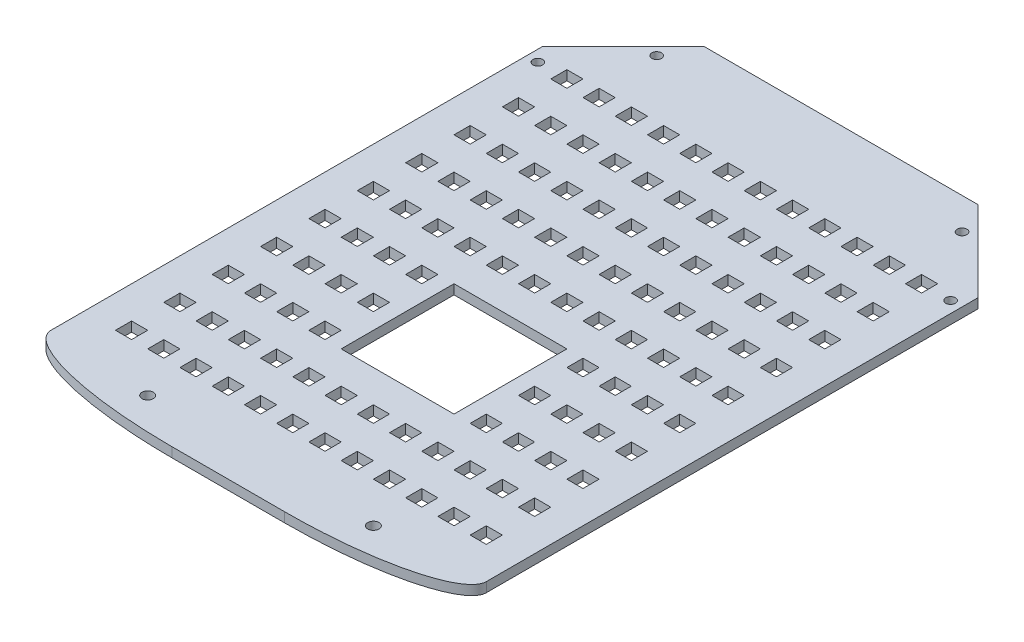
from build123d import *

# Parameters (mm, degrees)
SKETCH2_W           = 135
SKETCH2_H           = 190
BOSS_EXTRUDE2_DEPTH = 3
FILLET1_SIZE        = 50
FILLET1_SIZE_2      = 12.5
FILLET2_SIZE        = 12.5
FILLET2_SIZE_2      = 50
SKETCH6_R           = 1.75
CUT_EXTRUDE4_DEPTH  = 10
CHAMFER4_SIZE       = 25
SKETCH12_R          = 1.5
CUT_EXTRUDE10_DEPTH = 10
SKETCH13_W          = 5
SKETCH13_H          = 5
CUT_EXTRUDE11_DEPTH = 117.577227764
SKETCH14_W          = 35
SKETCH14_H          = 35
CUT_EXTRUDE13_DEPTH = 117.577227764


with BuildPart() as part:
    # Sketch2 → Boss-Extrude2 (new body)
    with BuildSketch(Plane(origin=(0, 0, 0), x_dir=(1, 0, 0), z_dir=(0, 1, 0))):
        Rectangle(SKETCH2_W, SKETCH2_H)
    extrude(amount=BOSS_EXTRUDE2_DEPTH)

    # Fillet1
    # an asymmetric fillet: 50, 12.5 mm, written as the material it takes off along each edge
    with BuildSketch(Plane(origin=(-67.5, -125, 95), x_dir=(1, 0, 0), z_dir=(0, 1, 0))) as fillet1_piece_1:
        with BuildLine():
            Bezier((FILLET1_SIZE, 0), (0, 0), (0, FILLET1_SIZE_2), weights=[1, 0.707106781, 1])
            Line((0, FILLET1_SIZE_2), (0, 0))
            Line((0, 0), (FILLET1_SIZE, 0))
        make_face()
    extrude(amount=253, mode=Mode.SUBTRACT)

    # Fillet2
    # an asymmetric fillet: 50, 12.5 mm, written as the material it takes off along each edge
    with BuildSketch(Plane(origin=(67.5, -125, 95), x_dir=(0, 0, -1), z_dir=(0, 1, 0))) as fillet2_piece_1:
        with BuildLine():
            Bezier((FILLET2_SIZE, 0), (0, 0), (0, FILLET2_SIZE_2), weights=[1, 0.707106781, 1])
            Line((0, FILLET2_SIZE_2), (0, 0))
            Line((0, 0), (FILLET2_SIZE, 0))
        make_face()
    extrude(amount=253, mode=Mode.SUBTRACT)

    # Sketch6 → Cut-Extrude4 (cut)
    with BuildSketch(Plane(origin=(0, 3, 0), x_dir=(1, 0, 0), z_dir=(0, 1, 0))):
        with Locations(Location((35, -85, 0), (0, 0, 270))):
            Circle(SKETCH6_R)
        with Locations(Location((-35, -85, 0), (0, 0, 270))):
            Circle(SKETCH6_R)
    extrude(amount=-CUT_EXTRUDE4_DEPTH, mode=Mode.SUBTRACT)

    # Chamfer4
    chamfer4_edges = [part.edges().sort_by_distance(p)[0] for p in [
        (67.5, 1.5, -95),
        (-67.5, 1.5, -95),
    ]]
    chamfer(chamfer4_edges, length=CHAMFER4_SIZE)

    # Sketch12 → Cut-Extrude10 (cut)
    with BuildSketch(Plane(origin=(0, 3, 0), x_dir=(1, 0, 0), z_dir=(0, 1, 0))):
        with Locations(Location((-47.347456736, 85.202795796, 0), (0, 0, 270))):
            Circle(SKETCH12_R)
        with Locations(Location((-64, 65, 0), (0, 0, 270))):
            Circle(SKETCH12_R)
        with Locations(Location((64, 65, 0), (0, 0, 270))):
            Circle(SKETCH12_R)
        with Locations(Location((47.347456736, 85.202795796, 0), (0, 0, 270))):
            Circle(SKETCH12_R)
    extrude(amount=-CUT_EXTRUDE10_DEPTH, mode=Mode.SUBTRACT)

    # Sketch13 → Cut-Extrude11 (cut, through all)
    with BuildSketch(Plane(origin=(0, 3, 0), x_dir=(1, 0, 0), z_dir=(0, 1, 0))):
        with Locations((-55, -70)):
            Rectangle(SKETCH13_W, SKETCH13_H)
        with Locations((-45, -70)):
            Rectangle(SKETCH13_W, SKETCH13_H)
        with Locations((-35, -70)):
            Rectangle(SKETCH13_W, SKETCH13_H)
        with Locations((-25, -70)):
            Rectangle(SKETCH13_W, SKETCH13_H)
        with Locations((-15, -70)):
            Rectangle(SKETCH13_W, SKETCH13_H)
        with Locations((-5, -70)):
            Rectangle(SKETCH13_W, SKETCH13_H)
        with Locations((5, -70)):
            Rectangle(SKETCH13_W, SKETCH13_H)
        with Locations((15, -70)):
            Rectangle(SKETCH13_W, SKETCH13_H)
        with Locations((25, -70)):
            Rectangle(SKETCH13_W, SKETCH13_H)
        with Locations((35, -70)):
            Rectangle(SKETCH13_W, SKETCH13_H)
        with Locations((45, -70)):
            Rectangle(SKETCH13_W, SKETCH13_H)
        with Locations((55, -70)):
            Rectangle(SKETCH13_W, SKETCH13_H)
        with Locations((-45, -55)):
            Rectangle(SKETCH13_W, SKETCH13_H)
        with Locations((-35, -55)):
            Rectangle(SKETCH13_W, SKETCH13_H)
        with Locations((-25, -55)):
            Rectangle(SKETCH13_W, SKETCH13_H)
        with Locations((-15, -55)):
            Rectangle(SKETCH13_W, SKETCH13_H)
        with Locations((-5, -55)):
            Rectangle(SKETCH13_W, SKETCH13_H)
        with Locations((5, -55)):
            Rectangle(SKETCH13_W, SKETCH13_H)
        with Locations((15, -55)):
            Rectangle(SKETCH13_W, SKETCH13_H)
        with Locations((25, -55)):
            Rectangle(SKETCH13_W, SKETCH13_H)
        with Locations((35, -55)):
            Rectangle(SKETCH13_W, SKETCH13_H)
        with Locations((45, -55)):
            Rectangle(SKETCH13_W, SKETCH13_H)
        with Locations((55, -55)):
            Rectangle(SKETCH13_W, SKETCH13_H)
        with Locations((-45, -40)):
            Rectangle(SKETCH13_W, SKETCH13_H)
        with Locations((-35, -40)):
            Rectangle(SKETCH13_W, SKETCH13_H)
        with Locations((-25, -40)):
            Rectangle(SKETCH13_W, SKETCH13_H)
        with Locations((-15, -40)):
            Rectangle(SKETCH13_W, SKETCH13_H)
        with Locations((-5, -40)):
            Rectangle(SKETCH13_W, SKETCH13_H)
        with Locations((5, -40)):
            Rectangle(SKETCH13_W, SKETCH13_H)
        with Locations((15, -40)):
            Rectangle(SKETCH13_W, SKETCH13_H)
        with Locations((25, -40)):
            Rectangle(SKETCH13_W, SKETCH13_H)
        with Locations((35, -40)):
            Rectangle(SKETCH13_W, SKETCH13_H)
        with Locations((45, -40)):
            Rectangle(SKETCH13_W, SKETCH13_H)
        with Locations((55, -40)):
            Rectangle(SKETCH13_W, SKETCH13_H)
        with Locations((-45, -25)):
            Rectangle(SKETCH13_W, SKETCH13_H)
        with Locations((-35, -25)):
            Rectangle(SKETCH13_W, SKETCH13_H)
        with Locations((-25, -25)):
            Rectangle(SKETCH13_W, SKETCH13_H)
        with Locations((-15, -25)):
            Rectangle(SKETCH13_W, SKETCH13_H)
        with Locations((-5, -25)):
            Rectangle(SKETCH13_W, SKETCH13_H)
        with Locations((5, -25)):
            Rectangle(SKETCH13_W, SKETCH13_H)
        with Locations((15, -25)):
            Rectangle(SKETCH13_W, SKETCH13_H)
        with Locations((25, -25)):
            Rectangle(SKETCH13_W, SKETCH13_H)
        with Locations((35, -25)):
            Rectangle(SKETCH13_W, SKETCH13_H)
        with Locations((45, -25)):
            Rectangle(SKETCH13_W, SKETCH13_H)
        with Locations((55, -25)):
            Rectangle(SKETCH13_W, SKETCH13_H)
        with Locations((-45, -10)):
            Rectangle(SKETCH13_W, SKETCH13_H)
        with Locations((-35, -10)):
            Rectangle(SKETCH13_W, SKETCH13_H)
        with Locations((-25, -10)):
            Rectangle(SKETCH13_W, SKETCH13_H)
        with Locations((-15, -10)):
            Rectangle(SKETCH13_W, SKETCH13_H)
        with Locations((-5, -10)):
            Rectangle(SKETCH13_W, SKETCH13_H)
        with Locations((5, -10)):
            Rectangle(SKETCH13_W, SKETCH13_H)
        with Locations((15, -10)):
            Rectangle(SKETCH13_W, SKETCH13_H)
        with Locations((25, -10)):
            Rectangle(SKETCH13_W, SKETCH13_H)
        with Locations((35, -10)):
            Rectangle(SKETCH13_W, SKETCH13_H)
        with Locations((45, -10)):
            Rectangle(SKETCH13_W, SKETCH13_H)
        with Locations((55, -10)):
            Rectangle(SKETCH13_W, SKETCH13_H)
        with Locations((-45, 5)):
            Rectangle(SKETCH13_W, SKETCH13_H)
        with Locations((-35, 5)):
            Rectangle(SKETCH13_W, SKETCH13_H)
        with Locations((-25, 5)):
            Rectangle(SKETCH13_W, SKETCH13_H)
        with Locations((-15, 5)):
            Rectangle(SKETCH13_W, SKETCH13_H)
        with Locations((-5, 5)):
            Rectangle(SKETCH13_W, SKETCH13_H)
        with Locations((5, 5)):
            Rectangle(SKETCH13_W, SKETCH13_H)
        with Locations((15, 5)):
            Rectangle(SKETCH13_W, SKETCH13_H)
        with Locations((25, 5)):
            Rectangle(SKETCH13_W, SKETCH13_H)
        with Locations((35, 5)):
            Rectangle(SKETCH13_W, SKETCH13_H)
        with Locations((45, 5)):
            Rectangle(SKETCH13_W, SKETCH13_H)
        with Locations((55, 5)):
            Rectangle(SKETCH13_W, SKETCH13_H)
        with Locations((-45, 20)):
            Rectangle(SKETCH13_W, SKETCH13_H)
        with Locations((-35, 20)):
            Rectangle(SKETCH13_W, SKETCH13_H)
        with Locations((-25, 20)):
            Rectangle(SKETCH13_W, SKETCH13_H)
        with Locations((-15, 20)):
            Rectangle(SKETCH13_W, SKETCH13_H)
        with Locations((-5, 20)):
            Rectangle(SKETCH13_W, SKETCH13_H)
        with Locations((5, 20)):
            Rectangle(SKETCH13_W, SKETCH13_H)
        with Locations((15, 20)):
            Rectangle(SKETCH13_W, SKETCH13_H)
        with Locations((25, 20)):
            Rectangle(SKETCH13_W, SKETCH13_H)
        with Locations((35, 20)):
            Rectangle(SKETCH13_W, SKETCH13_H)
        with Locations((45, 20)):
            Rectangle(SKETCH13_W, SKETCH13_H)
        with Locations((55, 20)):
            Rectangle(SKETCH13_W, SKETCH13_H)
        with Locations((-45, 35)):
            Rectangle(SKETCH13_W, SKETCH13_H)
        with Locations((-35, 35)):
            Rectangle(SKETCH13_W, SKETCH13_H)
        with Locations((-25, 35)):
            Rectangle(SKETCH13_W, SKETCH13_H)
        with Locations((-15, 35)):
            Rectangle(SKETCH13_W, SKETCH13_H)
        with Locations((-5, 35)):
            Rectangle(SKETCH13_W, SKETCH13_H)
        with Locations((5, 35)):
            Rectangle(SKETCH13_W, SKETCH13_H)
        with Locations((15, 35)):
            Rectangle(SKETCH13_W, SKETCH13_H)
        with Locations((25, 35)):
            Rectangle(SKETCH13_W, SKETCH13_H)
        with Locations((35, 35)):
            Rectangle(SKETCH13_W, SKETCH13_H)
        with Locations((45, 35)):
            Rectangle(SKETCH13_W, SKETCH13_H)
        with Locations((55, 35)):
            Rectangle(SKETCH13_W, SKETCH13_H)
        with Locations((-45, 50)):
            Rectangle(SKETCH13_W, SKETCH13_H)
        with Locations((-35, 50)):
            Rectangle(SKETCH13_W, SKETCH13_H)
        with Locations((-25, 50)):
            Rectangle(SKETCH13_W, SKETCH13_H)
        with Locations((-15, 50)):
            Rectangle(SKETCH13_W, SKETCH13_H)
        with Locations((-5, 50)):
            Rectangle(SKETCH13_W, SKETCH13_H)
        with Locations((5, 50)):
            Rectangle(SKETCH13_W, SKETCH13_H)
        with Locations((15, 50)):
            Rectangle(SKETCH13_W, SKETCH13_H)
        with Locations((25, 50)):
            Rectangle(SKETCH13_W, SKETCH13_H)
        with Locations((35, 50)):
            Rectangle(SKETCH13_W, SKETCH13_H)
        with Locations((45, 50)):
            Rectangle(SKETCH13_W, SKETCH13_H)
        with Locations((55, 50)):
            Rectangle(SKETCH13_W, SKETCH13_H)
        with Locations((-45, 65)):
            Rectangle(SKETCH13_W, SKETCH13_H)
        with Locations((-35, 65)):
            Rectangle(SKETCH13_W, SKETCH13_H)
        with Locations((-25, 65)):
            Rectangle(SKETCH13_W, SKETCH13_H)
        with Locations((-15, 65)):
            Rectangle(SKETCH13_W, SKETCH13_H)
        with Locations((-5, 65)):
            Rectangle(SKETCH13_W, SKETCH13_H)
        with Locations((5, 65)):
            Rectangle(SKETCH13_W, SKETCH13_H)
        with Locations((15, 65)):
            Rectangle(SKETCH13_W, SKETCH13_H)
        with Locations((25, 65)):
            Rectangle(SKETCH13_W, SKETCH13_H)
        with Locations((35, 65)):
            Rectangle(SKETCH13_W, SKETCH13_H)
        with Locations((45, 65)):
            Rectangle(SKETCH13_W, SKETCH13_H)
        with Locations((55, 65)):
            Rectangle(SKETCH13_W, SKETCH13_H)
        with Locations((-55, -55)):
            Rectangle(SKETCH13_W, SKETCH13_H)
        with Locations((-55, -40)):
            Rectangle(SKETCH13_W, SKETCH13_H)
        with Locations((-55, -25)):
            Rectangle(SKETCH13_W, SKETCH13_H)
        with Locations((-55, -10)):
            Rectangle(SKETCH13_W, SKETCH13_H)
        with Locations((-55, 5)):
            Rectangle(SKETCH13_W, SKETCH13_H)
        with Locations((-55, 20)):
            Rectangle(SKETCH13_W, SKETCH13_H)
        with Locations((-55, 35)):
            Rectangle(SKETCH13_W, SKETCH13_H)
        with Locations((-55, 50)):
            Rectangle(SKETCH13_W, SKETCH13_H)
        with Locations((-55, 65)):
            Rectangle(SKETCH13_W, SKETCH13_H)
    extrude(amount=-CUT_EXTRUDE11_DEPTH, mode=Mode.SUBTRACT)

    # Sketch14 → Cut-Extrude13 (cut, through all)
    with BuildSketch(Plane(origin=(0, 3, 0), x_dir=(1, 0, 0), z_dir=(0, 1, 0))):
        with Locations((0, -25)):
            Rectangle(SKETCH14_W, SKETCH14_H)
    extrude(amount=-CUT_EXTRUDE13_DEPTH, mode=Mode.SUBTRACT)


solid = part.part
